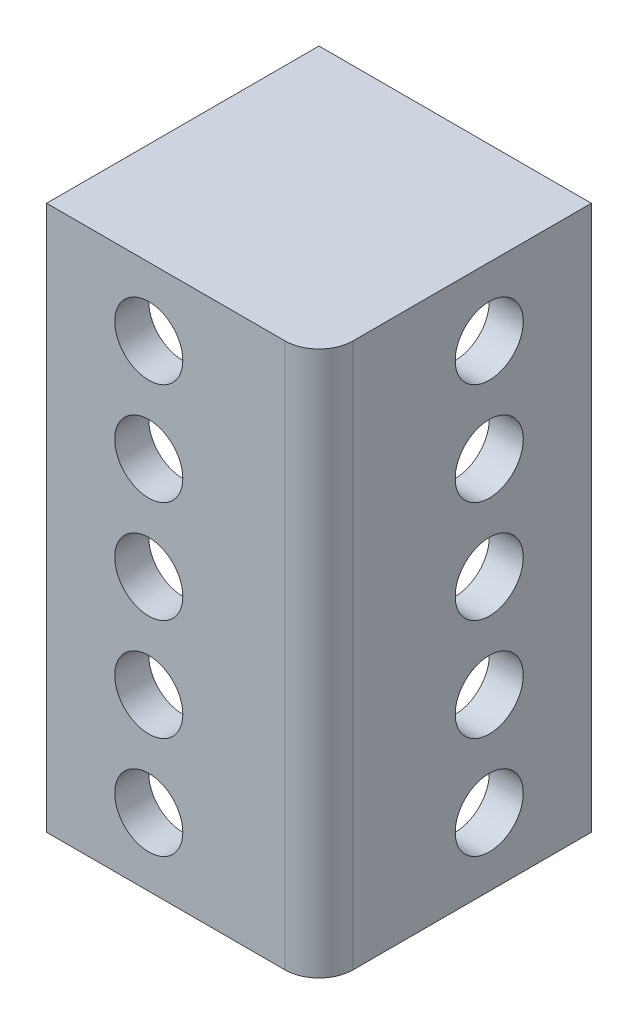
from build123d import *

# Parameters (mm, degrees)
SKETCH2_W           = 101.6
SKETCH2_H           = 101.6
BOSS_EXTRUDE1_DEPTH = 203.2
SKETCH4_W           = 88.9
SKETCH4_H           = 88.9
CUT_EXTRUDE1_DEPTH  = 95.25
FILLET1_R           = 12.7
SKETCH5_R           = 12.7
CUT_EXTRUDE2_DEPTH  = 236.037637651
SKETCH6_R           = 12.7
CUT_EXTRUDE3_DEPTH  = 240.711637365
CUT_EXTRUDE4_DEPTH  = 220.610297346


with BuildPart() as part:
    # Sketch2 → Boss-Extrude1 (new body)
    with BuildSketch(Plane(origin=(0, 0, 0), x_dir=(1, 0, 0), z_dir=(0, 1, 0))):
        with Locations((9.448577681, 25.677899344)):
            Rectangle(SKETCH2_W, SKETCH2_H)
    extrude(amount=BOSS_EXTRUDE1_DEPTH)

    # Sketch4 → Cut-Extrude1 (cut, symmetric)
    with BuildSketch(Plane(origin=(0, 101.6, 0), x_dir=(1, 0, 0), z_dir=(0, 1, 0))):
        with Locations((3.098577681, 32.027899344)):
            Rectangle(SKETCH4_W, SKETCH4_H)
    extrude(amount=CUT_EXTRUDE1_DEPTH, both=True, mode=Mode.SUBTRACT)

    # Fillet1
    fillet1_edges = [part.edges().sort_by_distance(p)[0] for p in [
        (60.248577681, 101.6, 25.122100656),
        (47.548577681, 101.6, 12.422100656),
    ]]
    fillet(fillet1_edges, radius=FILLET1_R)

    # Sketch5 → Cut-Extrude2 (cut, through all)
    with BuildSketch(Plane.XY.offset(25.122100656)):
        with Locations((-3.251422319, 177.8)):
            Circle(SKETCH5_R)
        with Locations((-3.251422319, 139.7)):
            Circle(SKETCH5_R)
        with Locations((-3.251422319, 101.6)):
            Circle(SKETCH5_R)
        with Locations((-3.251422319, 63.5)):
            Circle(SKETCH5_R)
        with Locations((-3.251422319, 25.4)):
            Circle(SKETCH5_R)
    extrude(amount=-CUT_EXTRUDE2_DEPTH, mode=Mode.SUBTRACT)

    # Sketch6 → Cut-Extrude3 (cut, through all)
    with BuildSketch(Plane(origin=(60.248577681, 0, 0), x_dir=(0, 0, -1), z_dir=(1, 0, 0))):
        with Locations((38.377899344, 177.8)):
            Circle(SKETCH6_R)
        with Locations((38.377899344, 139.7)):
            Circle(SKETCH6_R)
        with Locations((38.377899344, 101.6)):
            Circle(SKETCH6_R)
        with Locations((38.377899344, 63.5)):
            Circle(SKETCH6_R)
        with Locations((38.377899344, 25.4)):
            Circle(SKETCH6_R)
    extrude(amount=-CUT_EXTRUDE3_DEPTH, mode=Mode.SUBTRACT)

    # Sketch7 → Cut-Extrude4 (cut, through all)
    with BuildSketch(Plane(origin=(0, 6.35, 0), x_dir=(1, 0, 0), z_dir=(0, 1, 0))):
        with BuildLine():
            Line((-41.351422319, 76.477899344), (47.548577681, 76.477899344))
            Line((47.548577681, 76.477899344), (47.548577681, 0.277899344))
            ThreePointArc((47.548577681, 0.277899344), (43.828833802, -8.702356778), (34.848577681, -12.422100656))
            Line((34.848577681, -12.422100656), (-41.351422319, -12.422100656))
            Line((-41.351422319, -12.422100656), (-41.351422319, 76.477899344))
        make_face()
    extrude(amount=-CUT_EXTRUDE4_DEPTH, mode=Mode.SUBTRACT)


solid = part.part
